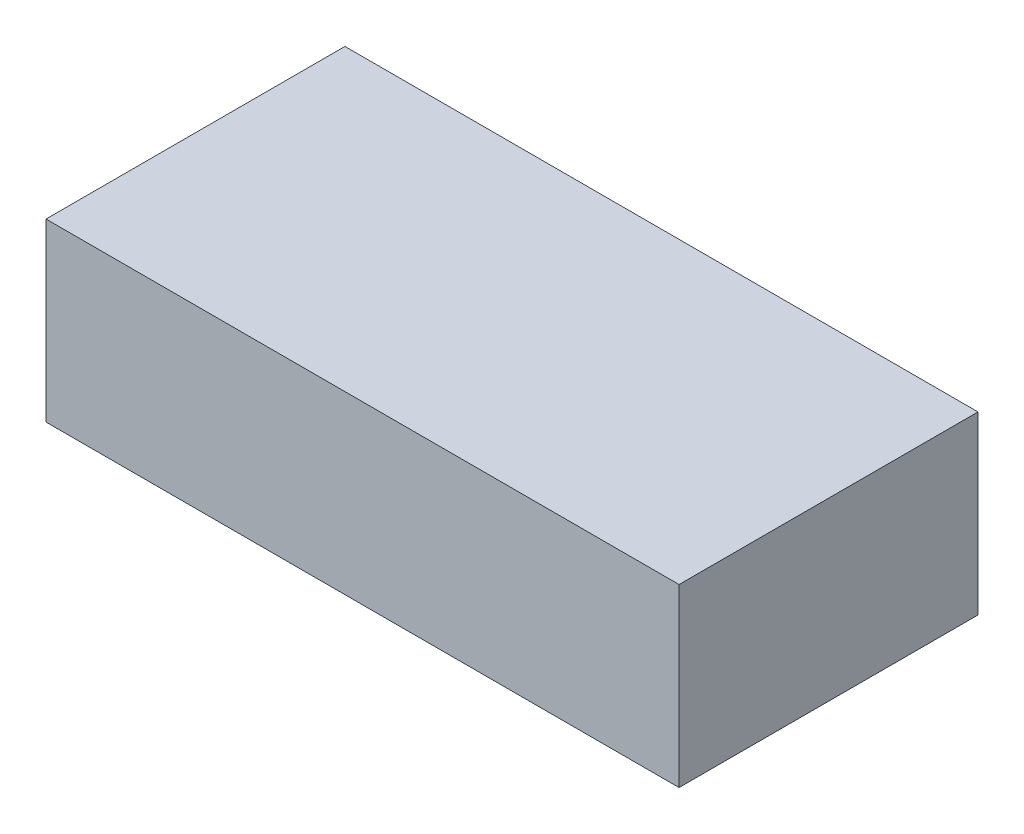
from build123d import *

# Parameters (mm, degrees)
SKETCH1_W           = 36.00008514
SKETCH1_H           = 10
BOSS_EXTRUDE1_DEPTH = 17


with BuildPart() as part:
    # Sketch1 → Boss-Extrude1 (new body)
    with BuildSketch(Plane.XY):
        with Locations((-99.406686207, -92.757283518)):
            Rectangle(SKETCH1_W, SKETCH1_H)
    extrude(amount=BOSS_EXTRUDE1_DEPTH)


solid = part.part
